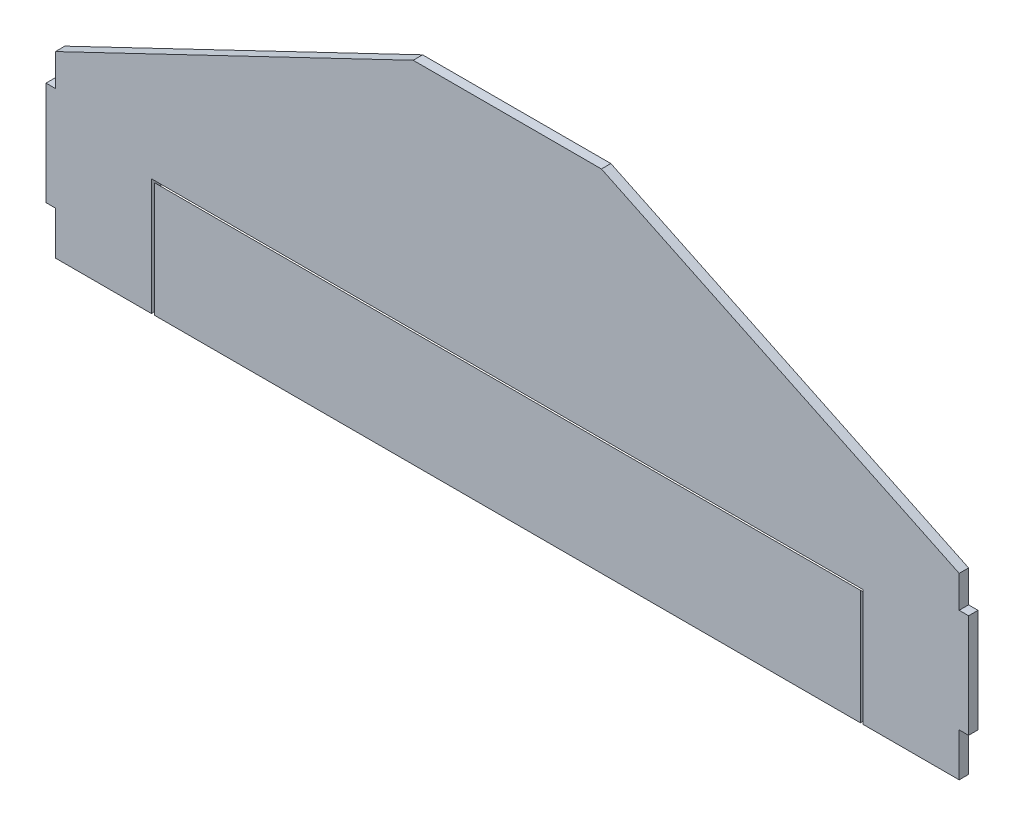
from build123d import *

# Parameters (mm, degrees)
GRUNDFL_CHE_DEPTH          = 5
SKIZZE3_W                  = 5
SKIZZE3_H                  = 55
ZAPFENSEITENLEITWERK_DEPTH = 5
H_HENLEITWERK_DEPTH        = 308.645900346
FASE1_SIZE                 = 5


with BuildPart() as part:
    # Skizze1 → Grundfläche (new body)
    with BuildSketch(Plane.XY):
        Polygon((240, 0), (-240, 0), (-240, 95), (-50, 186), (50, 186), (240, 95), align=None)
    extrude(amount=GRUNDFL_CHE_DEPTH)

    # Skizze3 → ZapfenSeitenleitwerk (add)
    with BuildSketch(Plane.XY.offset(5)):
        with Locations((242.5, 50.5)):
            Rectangle(SKIZZE3_W, SKIZZE3_H)
        with Locations((-242.5, 50.5)):
            Rectangle(SKIZZE3_W, SKIZZE3_H)
    extrude(amount=-ZAPFENSEITENLEITWERK_DEPTH)

    # Skizze4 → Höhenleitwerk (cut, through all)
    with BuildSketch(Plane.XY.offset(5)):
        Polygon((-187.5, 0), (-189, 0), (-189, 62), (-187.5, 62), (187.5, 62), (189, 62), (189, 0), (187.5, 0), (187.5, 61), (-187.5, 61), align=None)
    extrude(amount=-H_HENLEITWERK_DEPTH, mode=Mode.SUBTRACT)


with BuildPart() as h_henleitwerk_piece_1:
    # of the separate pieces the step leaves, piece 1, a body of its own (h_henleitwerk_pieces)
    add(part.part.solids().sort_by_distance((240, 0, 0))[0])


with BuildPart() as h_henleitwerk_piece_2:
    # of the separate pieces the step leaves, piece 2, a body of its own (h_henleitwerk_pieces)
    add(part.part.solids().sort_by_distance((187.5, 0, 0))[0])

    # Fase1
    fase1_edges = [h_henleitwerk_piece_2.edges().sort_by_distance(p)[0] for p in [
        (0, 61, 0),
    ]]
    chamfer(fase1_edges, length=FASE1_SIZE - 0.0001)  # a hair under: the kernel refuses the full size


solid = Compound([h_henleitwerk_piece_1.part, h_henleitwerk_piece_2.part])
